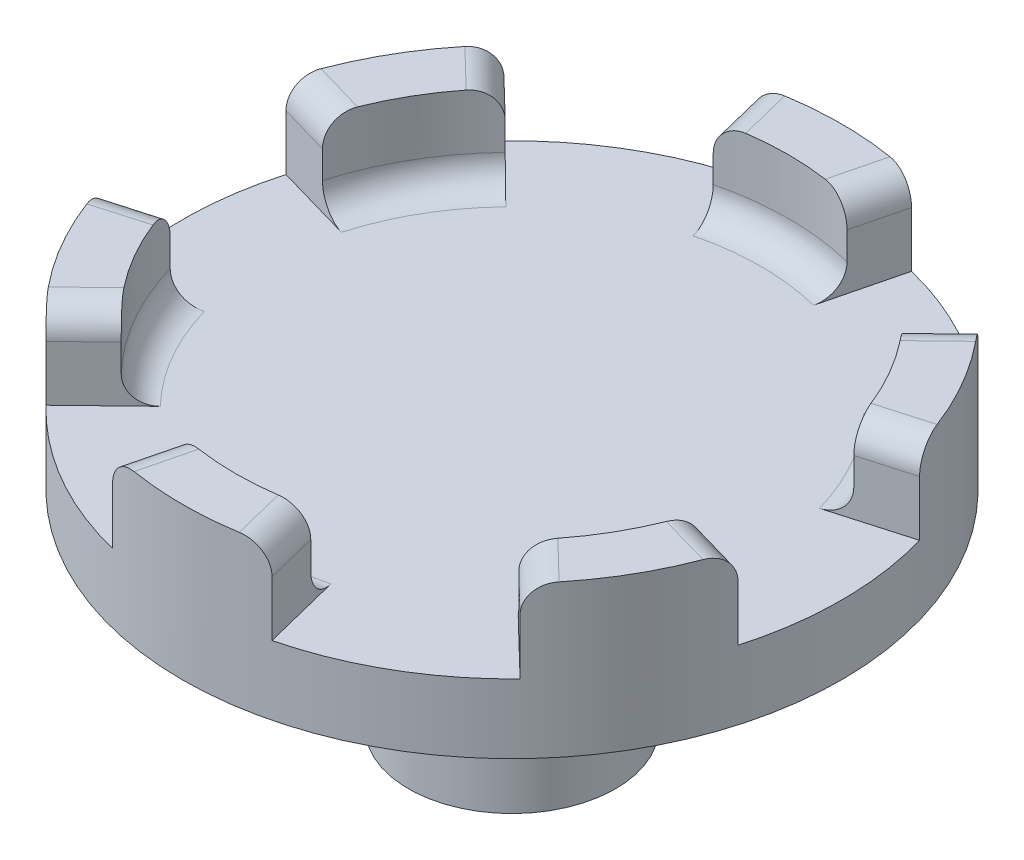
from build123d import *

# Parameters (mm, degrees)
SKETCH1_R           = 30.2895
BOSS_EXTRUDE1_DEPTH = 6.35
BOSS_EXTRUDE2_DEPTH = 7.62
FILLET1_R           = 2.54
SKETCH3_R           = 12.7
BOSS_EXTRUDE3_DEPTH = 6.35
FILLET2_R           = 2.54
SKETCH4_R           = 9.525
BOSS_EXTRUDE4_DEPTH = 12.7


with BuildPart() as part:
    # Sketch1 → Boss-Extrude1 (new body)
    with BuildSketch(Plane(origin=(0, 0, 0), x_dir=(1, 0, 0), z_dir=(0, 1, 0))):
        Circle(SKETCH1_R)
    extrude(amount=BOSS_EXTRUDE1_DEPTH)

    # Sketch2 → Boss-Extrude2 (add)
    with BuildSketch(Plane(origin=(0, 6.35, 0), x_dir=(1, 0, 0), z_dir=(0, 1, 0))):
        with BuildLine():
            ThreePointArc((6.148158832, -24.644677782), (0, -25.4), (-6.148158832, -24.644677782))
            Line((-6.148158832, -24.644677782), (-7.331679408, -29.388778255))
            ThreePointArc((-7.331679408, -29.388778255), (0, -30.2895), (7.331679408, -29.388778255))
            Line((7.331679408, -29.388778255), (6.148158832, -24.644677782))
        make_face()
        with BuildLine():
            ThreePointArc((-29.117268259, -8.344968508), (-26.231476468, -15.14475), (-21.785588851, -21.043809747))
            Line((-21.785588851, -21.043809747), (-18.268837611, -17.646800626))
            ThreePointArc((-18.268837611, -17.646800626), (-21.997045256, -12.7), (-24.416996443, -6.997877156))
            Line((-24.416996443, -6.997877156), (-29.117268259, -8.344968508))
        make_face()
        with BuildLine():
            Line((18.268837611, -17.646800626), (21.785588851, -21.043809747))
            ThreePointArc((21.785588851, -21.043809747), (26.231476468, -15.14475), (29.117268259, -8.344968508))
            Line((29.117268259, -8.344968508), (24.416996443, -6.997877156))
            ThreePointArc((24.416996443, -6.997877156), (21.997045256, -12.7), (18.268837611, -17.646800626))
        make_face()
        with BuildLine():
            ThreePointArc((-21.785588851, 21.043809747), (-26.231476468, 15.14475), (-29.117268259, 8.344968508))
            Line((-29.117268259, 8.344968508), (-24.416996443, 6.997877156))
            ThreePointArc((-24.416996443, 6.997877156), (-21.997045256, 12.7), (-18.268837611, 17.646800626))
            Line((-18.268837611, 17.646800626), (-21.785588851, 21.043809747))
        make_face()
        with BuildLine():
            Line((24.416996443, 6.997877156), (29.117268259, 8.344968508))
            ThreePointArc((29.117268259, 8.344968508), (26.231476468, 15.14475), (21.785588851, 21.043809747))
            Line((21.785588851, 21.043809747), (18.268837611, 17.646800626))
            ThreePointArc((18.268837611, 17.646800626), (21.997045256, 12.7), (24.416996443, 6.997877156))
        make_face()
        with BuildLine():
            ThreePointArc((7.331679408, 29.388778255), (0, 30.2895), (-7.331679408, 29.388778255))
            Line((-7.331679408, 29.388778255), (-6.148158832, 24.644677782))
            ThreePointArc((-6.148158832, 24.644677782), (0, 25.4), (6.148158832, 24.644677782))
            Line((6.148158832, 24.644677782), (7.331679408, 29.388778255))
        make_face()
    extrude(amount=BOSS_EXTRUDE2_DEPTH)

    # Fillet1
    fillet1_edges = [part.edges().sort_by_distance(p)[0] for p in [
        (26.767132351, 13.97, 7.671422832),
        (26.767132351, 13.97, -7.671422832),
        (20.027213231, 13.97, -19.345305187),
        (6.73991912, 13.97, -27.016728018),
        (-6.73991912, 13.97, -27.016728018),
        (-20.027213231, 13.97, -19.345305187),
        (-26.767132351, 13.97, -7.671422832),
        (-26.767132351, 13.97, 7.671422832),
        (-20.027213231, 13.97, 19.345305187),
        (-6.73991912, 13.97, 27.016728018),
        (20.027213231, 13.97, 19.345305187),
        (6.73991912, 13.97, 27.016728018),
    ]]
    fillet(fillet1_edges, radius=FILLET1_R)

    # Sketch3 → Boss-Extrude3 (add)
    with BuildSketch(Plane.XZ):
        Circle(SKETCH3_R)
    extrude(amount=BOSS_EXTRUDE3_DEPTH)

    # Fillet2
    fillet2_edges = [part.edges().sort_by_distance(p)[0] for p in [
        (-21.997045256, 6.35, 12.7),
        (-21.997045256, 6.35, -12.7),
        (0, 6.35, -25.4),
        (21.997045256, 6.35, -12.7),
        (0, 6.35, 25.4),
        (21.997045256, 6.35, 12.7),
    ]]
    fillet(fillet2_edges, radius=FILLET2_R)

    # Sketch4 → Boss-Extrude4 (add)
    with BuildSketch(Plane.XZ.offset(6.35)):
        Circle(SKETCH4_R)
    extrude(amount=BOSS_EXTRUDE4_DEPTH)


solid = part.part
